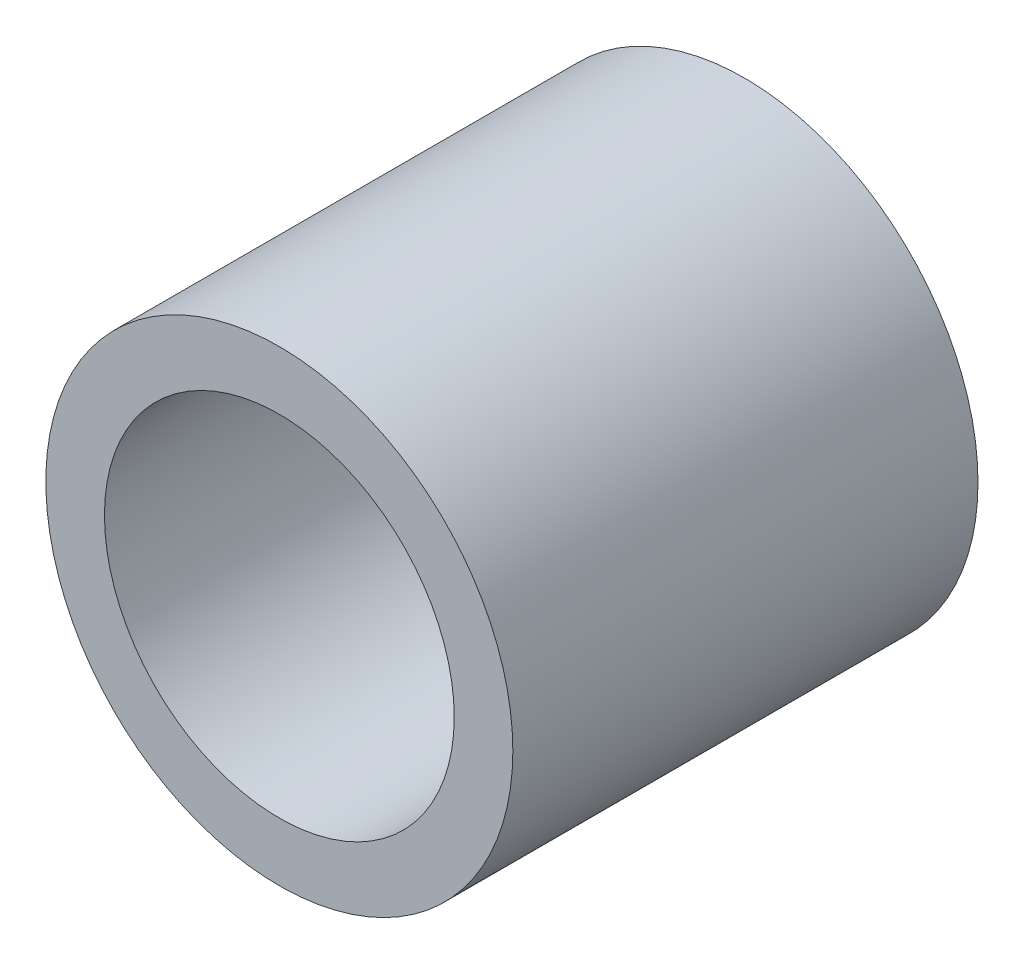
from build123d import *

# Parameters (mm, degrees)
SKETCH1_R      = 6.3754
SKETCH1_R_2    = 4.7752
EXTRUDE1_DEPTH = 6.35


with BuildPart() as part:
    # Sketch1 → Extrude1 (new, symmetric)
    with BuildSketch(Plane.XY):
        Circle(SKETCH1_R)
        Circle(SKETCH1_R_2, mode=Mode.SUBTRACT)
    extrude(amount=EXTRUDE1_DEPTH, both=True)


solid = part.part
